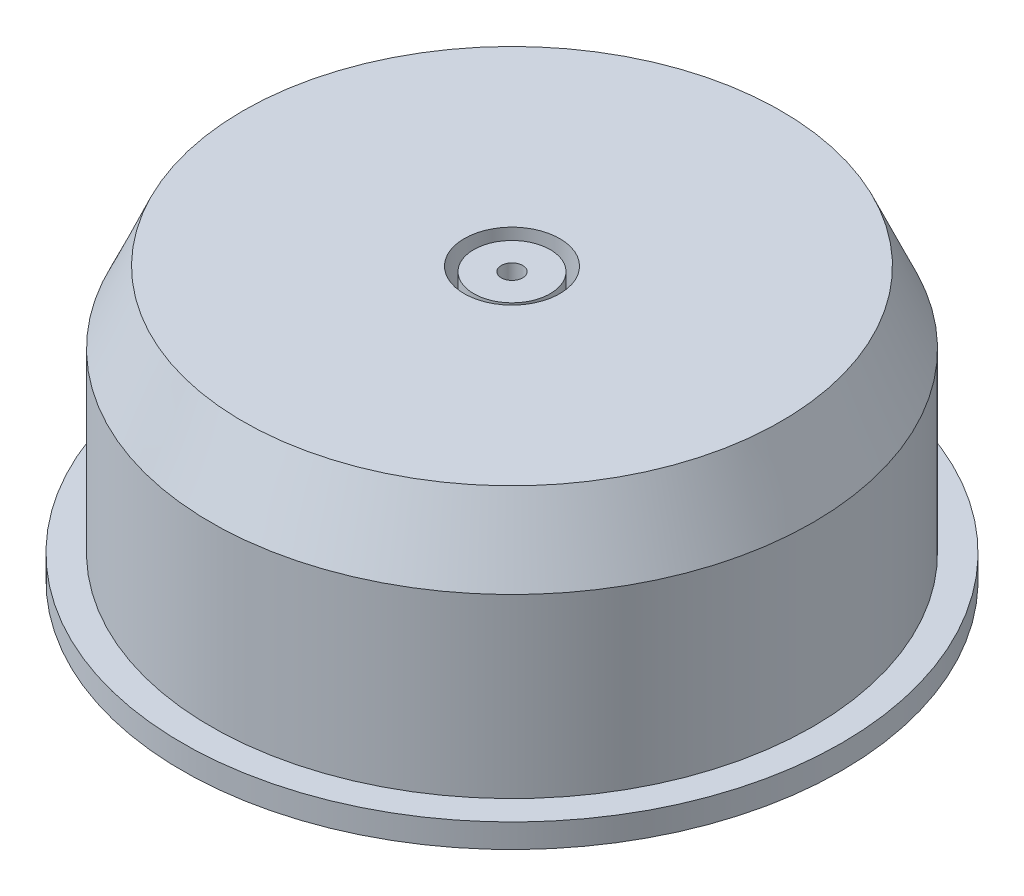
from build123d import *

# Parameters (mm, degrees)
EXTRUDE_START            = 27
SKETCH_3_R               = 8
EXTRUDE_1_DEPTH          = 27
SKETCH_4_W               = 21.869380784
SKETCH_4_H               = 6.809627549
CUT_EXTRUDE_1_DEPTH      = 46
SKETCH_5_R               = 3.5
CUT_EXTRUDE_2_DEPTH      = 70
PATTERN_CIRCULAR_1_COUNT = 6
HOLE_WIZARD_M41_D        = 4.5
HOLE_WIZARD_M41_DEPTH    = 14
HOLE_WIZARD_M41_TIP      = 1.351936393
SKETCH_14_R              = 9.95061624
SKETCH_14_R_2            = 8
CUT_EXTRUDE_5_DEPTH      = 10


with BuildPart() as part:
    # Эскиз2 → Повернуть1 (revolve)
    with BuildSketch(Plane.XY):
        Polygon((-10, -1.978246769), (-56.333333333, -1.978246769), (-63, -16.978246769), (-63, -53.978246769), (-69, -53.978246769), (-69, -58.978246769), (-34.298944769, -58.978246769), (-25.298944769, -62.978246769), (0, -62.978246769), (0, -2.978246769), (-8, -2.978246769), (-8, -13.730591033), (-10, -13.730591033), align=None)
    revolve(axis=Axis((0, -2.978246769, 0), (0, -1, 0)))

    # Эскиз3 → Бобышка-Вытянуть1 (add)
    with BuildSketch(Plane.XZ.offset(62.978246769).offset(EXTRUDE_START)):
        Circle(SKETCH_3_R)
    extrude(amount=-EXTRUDE_1_DEPTH)

    # Эскиз4 → Вырез-Вытянуть1 (cut)
    with BuildSketch(Plane.XZ.offset(89.978246769)):
        with Locations((-0.065477188, 8.404813774)):
            Rectangle(SKETCH_4_W, SKETCH_4_H)
    extrude(amount=-CUT_EXTRUDE_1_DEPTH, mode=Mode.SUBTRACT)

    # Эскиз5 → Вырез-Вытянуть2 (cut)
    with BuildSketch(Plane.XZ.offset(89.978246769)):
        Circle(SKETCH_5_R)
    extrude(amount=-CUT_EXTRUDE_2_DEPTH, mode=Mode.SUBTRACT)

    # Эскиз7 → Зенковка для винта с полупотайной головкой M51 (revolve, cut)
    with BuildSketch(Plane(origin=(-1.157683247, -58.978246769, -60), x_dir=(0, 0, -1), z_dir=(1, 0, 0))):
        Polygon((0, 0), (0, 15.652366702), (2.75, 14), (2.75, 2.45), (5.2, 0), align=None)
    hole_wizard_m51 = revolve(axis=Axis((-1.157683247, -65.328246769, -60), (0, 1, 0)), mode=Mode.SUBTRACT)

    # Круговой массив1: Зенковка для винта с полупотайной головкой M51 ×6 about axis
    pattern_circular_1_axis = Axis((0, -58.978246769, 0), (0, 1, 0))
    for i in range(1, PATTERN_CIRCULAR_1_COUNT):
        add(hole_wizard_m51.rotate(pattern_circular_1_axis, i * 360 / PATTERN_CIRCULAR_1_COUNT), mode=Mode.SUBTRACT)

    # Отверстие с зазором M41
    with Locations(Plane(origin=(0, -2.978246769, 0), x_dir=(1, 0, 0), z_dir=(0, 1, 0))):
        with Locations((0, 0)):
            Hole(HOLE_WIZARD_M41_D / 2, depth=HOLE_WIZARD_M41_DEPTH)
            with Locations((0, 0, -(HOLE_WIZARD_M41_DEPTH + HOLE_WIZARD_M41_TIP / 2))):  # 118° drill point
                Cone(0, HOLE_WIZARD_M41_D / 2, HOLE_WIZARD_M41_TIP, mode=Mode.SUBTRACT)

    # Эскиз14 → Вырез-Вытянуть5 (cut)
    with BuildSketch(Plane.XZ.offset(62.978246769)):
        Circle(SKETCH_14_R)
        Circle(SKETCH_14_R_2, mode=Mode.SUBTRACT)
    extrude(amount=-CUT_EXTRUDE_5_DEPTH, mode=Mode.SUBTRACT)


solid = part.part
